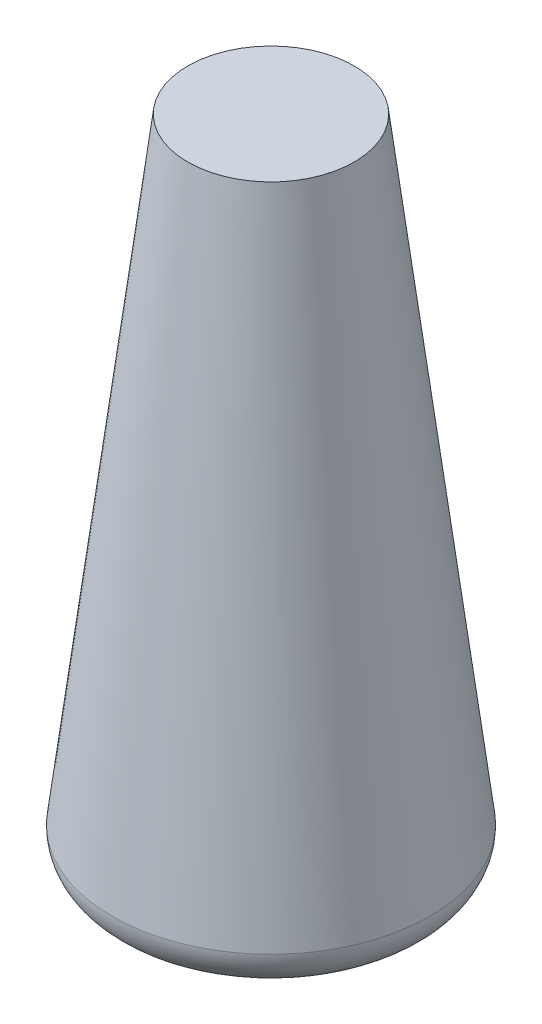
from build123d import *

# Parameters (mm, degrees)
SKETCH2_R           = 40
BOSS_EXTRUDE2_DEPTH = 10
SKETCH3_R           = 40
BOSS_EXTRUDE4_DEPTH = 155
BOSS_EXTRUDE4_TAPER = 7
FILLET4_R           = 10


with BuildPart() as part:
    # Sketch2 → Boss-Extrude2 (new body)
    with BuildSketch(Plane(origin=(0, 0, 0), x_dir=(1, 0, 0), z_dir=(0, 1, 0))):
        with Locations(Location((0, 0, 0), (0, 0, 270))):
            Circle(SKETCH2_R)
    extrude(amount=BOSS_EXTRUDE2_DEPTH)

    # Sketch3 → Boss-Extrude4 (add)
    with BuildSketch(Plane(origin=(0, 10, 0), x_dir=(1, 0, 0), z_dir=(0, 1, 0))):
        with Locations(Location((0, 0, 0), (0, 0, 270))):
            Circle(SKETCH3_R)
    extrude(amount=BOSS_EXTRUDE4_DEPTH, taper=BOSS_EXTRUDE4_TAPER)

    # Fillet4
    fillet4_edges = [part.edges().sort_by_distance(p)[0] for p in [
        (0, 0, -40),
    ]]
    fillet(fillet4_edges, radius=FILLET4_R - 0.0001)  # a hair under: the kernel refuses the full size


solid = part.part
